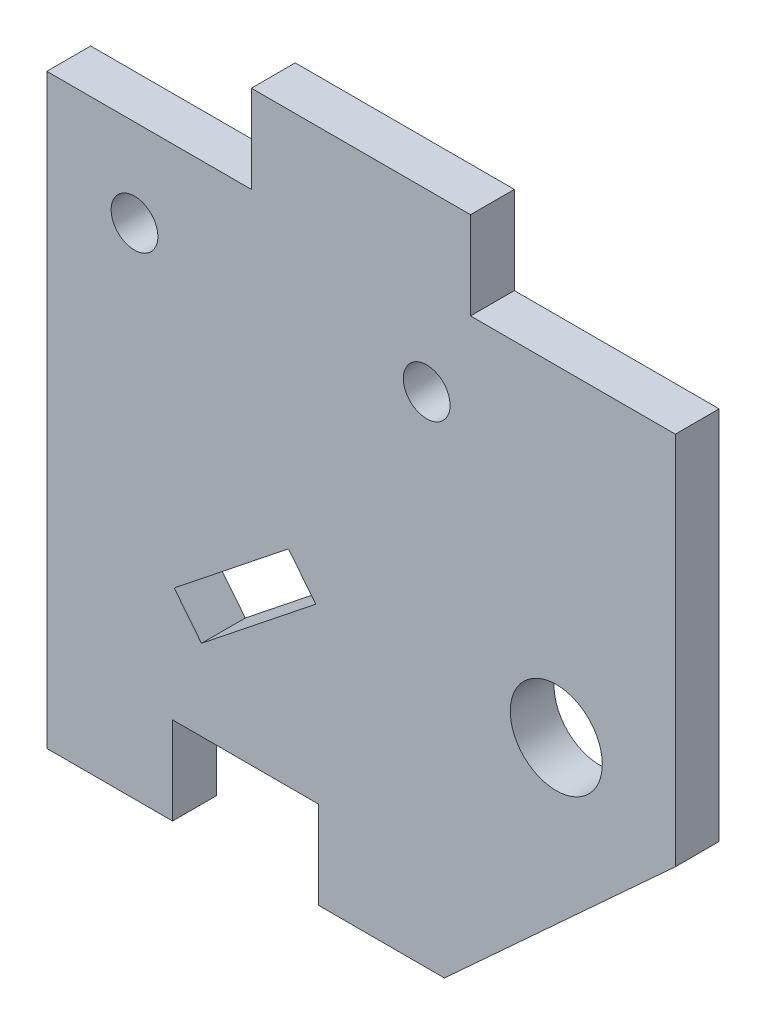
from build123d import *

# Parameters (mm, degrees)
ESBO_O1_R                = 3.15
ESBO_O1_R_2              = 1.6
RESSALTO_EXTRUS_O1_DEPTH = 3


with BuildPart() as part:
    # Esboço1 → Ressalto-extrusão1 (new body)
    with BuildSketch(Plane.XY):
        Polygon((14, 0), (0, 0), (0, -40.141590881), (8.606226741, -40.141590881), (8.606226741, -34.141590881), (18.606226741, -34.141590881), (18.606226741, -40.141590881), (27.212453482, -40.141590881), (43.018363872, -25.646635902), (43.018363872, 0), (29, 0), (29, 6), (14, 6), align=None)
        Polygon((18.407599994, -22.386075104), (10.584463287, -28.614921873), (8.715809256, -26.26798086), (16.538945963, -20.039134092), align=None, mode=Mode.SUBTRACT)
        with Locations((34.868363872, -22.062473973)):
            Circle(ESBO_O1_R, mode=Mode.SUBTRACT)
        with Locations((6, -6)):
            Circle(ESBO_O1_R_2, mode=Mode.SUBTRACT)
        with Locations((26, -6)):
            Circle(ESBO_O1_R_2, mode=Mode.SUBTRACT)
    extrude(amount=RESSALTO_EXTRUS_O1_DEPTH)


solid = part.part
